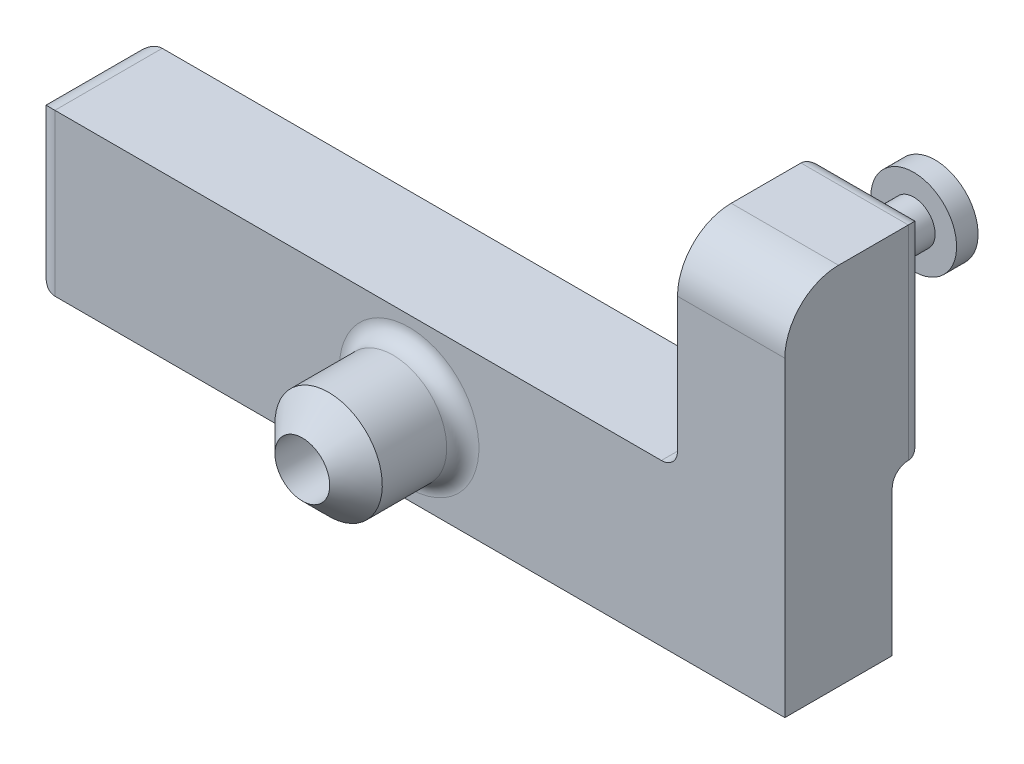
from build123d import *

# Parameters (mm, degrees)
SKETCH1_W                = 70
SKETCH1_H                = 15
SKETCH1_R                = 2.55
BOSS_EXTRUDE1_DEPTH      = 10
BOSS_EXTRUDE5_DEPTH      = 3
BOSS_EXTRUDE5_DEPTH_BACK = 10
SKETCH5_W                = 10
SKETCH5_H                = 19
FILLET1_R                = 2
SKETCH3_R                = 2
BOSS_EXTRUDE6_DEPTH      = 4
SKETCH6_R                = 4
BOSS_EXTRUDE7_DEPTH      = 2
FILLET4_R                = 5
FILLET3_R                = 1.5
FILLET9_R                = 1.5
SKETCH9_R                = 2.55
CUT_EXTRUDE1_DEPTH       = 10
FILLET10_R               = 1.5


# Some blends are built 0.0001 mm under size
with BuildPart() as part:
    # Sketch1 → Boss-Extrude1 (new body)
    with BuildSketch(Plane.XY):
        Rectangle(SKETCH1_W, SKETCH1_H)
        Circle(SKETCH1_R, mode=Mode.SUBTRACT)
    extrude(amount=BOSS_EXTRUDE1_DEPTH)

    # Fillet1
    fillet1_edges = [part.edges().sort_by_distance(p)[0] for p in [
        (-35, 0, 10),
        (-35, 0, 0),
        (-35, 7.5, 5),
        (-35, -7.5, 5),
    ]]
    fillet(fillet1_edges, radius=FILLET1_R)


with BuildPart() as body_2:
    # Sketch5 → Boss-Extrude5 (new, two sides: drawn at the far end of the back side and taken through both)
    with BuildSketch(Plane(origin=(0, 0, 0), x_dir=(-1, 0, 0), z_dir=(0, 0, -1)).offset(-BOSS_EXTRUDE5_DEPTH_BACK)):
        with Locations((-30, 17)):
            Rectangle(SKETCH5_W, SKETCH5_H)
    extrude(amount=BOSS_EXTRUDE5_DEPTH + BOSS_EXTRUDE5_DEPTH_BACK)

    # Fillet4
    fillet4_edges = [body_2.edges().sort_by_distance(p)[0] for p in [
        (30, 26.5, 10),
    ]]
    fillet(fillet4_edges, radius=FILLET4_R)


with BuildPart() as body_3:
    # Sketch3 → Boss-Extrude6 (new body)
    with BuildSketch(Plane(origin=(-35, 0, -3), x_dir=(-1, 0, 0), z_dir=(0, 0, -1))):
        with Locations((-65, 21.5)):
            Circle(SKETCH3_R)
    extrude(amount=BOSS_EXTRUDE6_DEPTH)


with BuildPart() as body_4:
    # Sketch6 → Boss-Extrude7 (new body)
    with BuildSketch(Plane(origin=(0, 0, -7), x_dir=(-1, 0, 0), z_dir=(0, 0, -1))):
        with Locations((-30, 21.5)):
            Circle(SKETCH6_R)
    extrude(amount=BOSS_EXTRUDE7_DEPTH)


with BuildPart() as body_3_1:
    add(body_3.part)

    # Combine1: union body 2, body 4, part
    add(body_2.part)
    add(body_4.part)
    add(part.part)

    # Fillet3
    # the kernel refuses this fillet: 1.5 mm, written as the material it adds along each edge
    with BuildSketch(Plane(origin=(35, 7.5, 0), x_dir=(0, 0, -1), z_dir=(-1, 0, 0))) as fillet3_piece_1:
        with BuildLine():
            CenterArc((FILLET3_R, FILLET3_R), FILLET3_R, 180, 90)
            Line((0, FILLET3_R), (0, 0))
            Line((0, 0), (FILLET3_R, 0))
        make_face()
    extrude(amount=10)
    # the kernel refuses this fillet: 1.5 mm, written as the material it takes off along each edge
    with BuildSketch(Plane(origin=(21.25, 7.5, -3), x_dir=(0, 1, 0), z_dir=(1, 0, 0))) as fillet3_2_piece_1:
        with BuildLine():
            CenterArc((FILLET3_R, FILLET3_R), FILLET3_R, 180, 90)
            Line((0, FILLET3_R), (0, 0))
            Line((0, 0), (FILLET3_R, 0))
        make_face()
    extrude(amount=17.5, mode=Mode.SUBTRACT)
    with BuildSketch(Plane(origin=(25, 30.25, -3), x_dir=(0, 0, 1), z_dir=(0, -1, 0))) as fillet3_2_piece_2:
        with BuildLine():
            CenterArc((FILLET3_R, -FILLET3_R), FILLET3_R, 90, 90)
            Line((0, -FILLET3_R), (0, 0))
            Line((0, 0), (FILLET3_R, 0))
        make_face()
    extrude(amount=26.5, mode=Mode.SUBTRACT)
    with BuildSketch(Plane(origin=(38.75, 26.5, -3), x_dir=(0, 0, 1), z_dir=(-1, 0, 0))) as fillet3_2_piece_3:
        with BuildLine():
            CenterArc((FILLET3_R, -FILLET3_R), FILLET3_R, 90, 90)
            Line((0, -FILLET3_R), (0, 0))
            Line((0, 0), (FILLET3_R, 0))
        make_face()
    extrude(amount=17.5, mode=Mode.SUBTRACT)
    with BuildSketch(Plane(origin=(35, 3.75, -3), x_dir=(-1, 0, 0), z_dir=(0, 1, 0))) as fillet3_2_piece_4:
        with BuildLine():
            CenterArc((FILLET3_R, FILLET3_R), FILLET3_R, 180, 90)
            Line((0, FILLET3_R), (0, 0))
            Line((0, 0), (FILLET3_R, 0))
        make_face()
    extrude(amount=26.5, mode=Mode.SUBTRACT)

    # Fillet9
    fillet9_edges = [body_3_1.edges().sort_by_distance(p)[0] for p in [
        (25, 6.75, 0),
        (25, 7.5, 5),
    ]]
    fillet(fillet9_edges, radius=FILLET9_R - 0.0001)  # a hair under: the kernel refuses the full size

    # Sketch8 → Revolve1 (revolve)
    with BuildSketch(Plane(origin=(0, 0, 0), x_dir=(0, 0, -1), z_dir=(1, 0, 0))):
        Polygon((-10, 0), (-20, 0), (-20, 2.5), (-17.5, 5), (-10, 5), align=None)
    revolve(axis=Axis((0, 0, 10), (0, 0, 1)))

    # Sketch9 → Cut-Extrude1 (cut)
    with BuildSketch(Plane(origin=(0, 0, 10), x_dir=(-1, 0, 0), z_dir=(0, 0, -1))):
        with Locations(Location((0, 0, 0), (0, 0, 90))):
            Circle(SKETCH9_R)
    extrude(amount=-CUT_EXTRUDE1_DEPTH, mode=Mode.SUBTRACT)

    # Fillet10
    fillet10_edges = [body_3_1.edges().sort_by_distance(p)[0] for p in [
        (0, -5, 10),
    ]]
    fillet(fillet10_edges, radius=FILLET10_R)


solid = body_3_1.part
